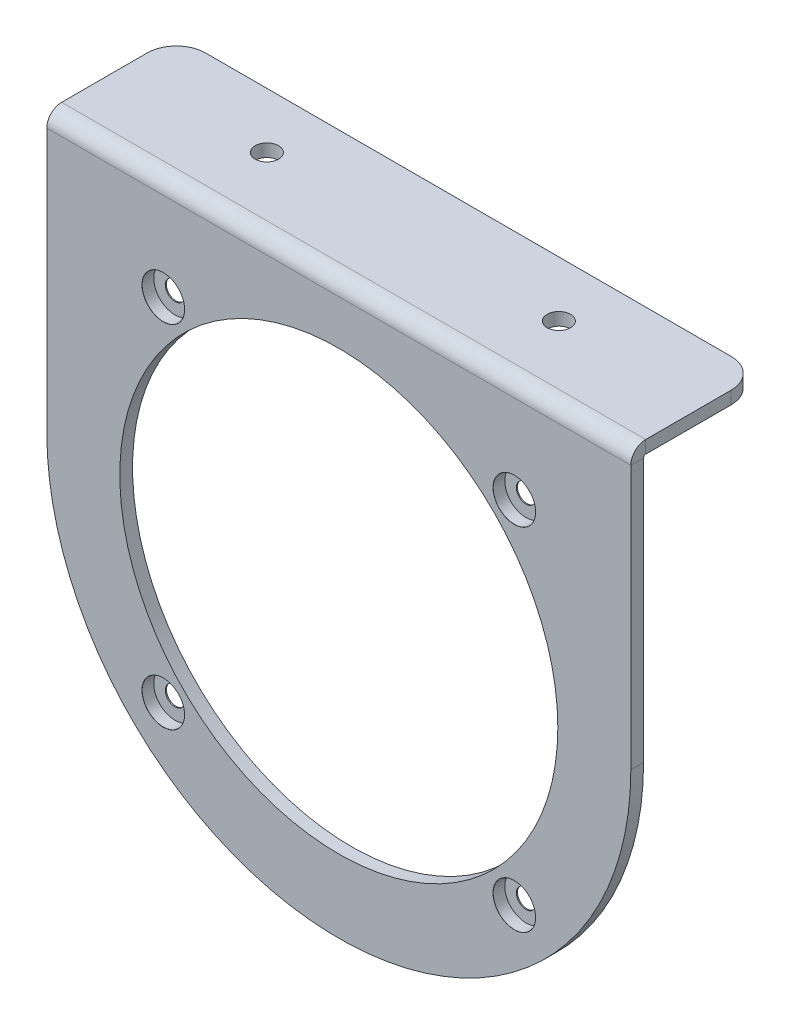
from build123d import *

# Parameters (mm, degrees)
BASE_FLANGE1_DEPTH           = 4.365
EDGE_FLANGE1_STRIP_W         = 18.9332
EDGE_FLANGE1_STRIP_H         = 4.365
EDGE_FLANGE1_STRIP_CUT_DEPTH = 200
EDGE_FLANGE1_DEPTH           = 200
SKETCH10_R                   = 75
CUT_EXTRUDE1_DEPTH           = 10
FILLET1_R                    = 10
SKETCH12_R                   = 4
CUT_EXTRUDE3_DEPTH           = 10
CIRPATTERN1_COUNT            = 4


# Sheet-metal steps are written as plain solids
with BuildPart() as part:
    # Sketch2 → Base-Flange1 (new body)
    with BuildSketch(Plane.XY):
        with BuildLine():
            Line((-100, 0), (-100, 95.4))
            Line((-100, 95.4), (100, 95.4))
            Line((100, 95.4), (100, 0))
            ThreePointArc((100, 0), (0, -100), (-100, 0))
        make_face()
    extrude(amount=-BASE_FLANGE1_DEPTH)

    # Edge-Flange1 strip (across the edge) → Edge-Flange1 strip cut (cut)
    with BuildSketch(Plane(origin=(-100, 95.4, -4.365), x_dir=(0, -1, 0), z_dir=(1, 0, 0))):
        with Locations((-4.365, -2.1825)):
            Rectangle(EDGE_FLANGE1_STRIP_W, EDGE_FLANGE1_STRIP_H)
    extrude(amount=EDGE_FLANGE1_STRIP_CUT_DEPTH, mode=Mode.SUBTRACT)

    # Edge-Flange1 section (across the edge) → Edge-Flange1 (add)
    with BuildSketch(Plane(origin=(-100, 95.4, -4.365), x_dir=(0, -1, 0), z_dir=(1, 0, 0))):
        with BuildLine():
            Line((0, 0.7366), (0, 40))
            Line((0, 40), (4.365, 40))
            Line((4.365, 40), (4.365, 0.7366))
            ThreePointArc((4.365, 0.7366), (4.580745145, 0.215745145), (5.1016, 0))
            Line((5.1016, 0), (5.1016, -4.365))
            ThreePointArc((5.1016, -4.365), (1.494224045, -2.870775955), (0, 0.7366))
        make_face()
    extrude(amount=EDGE_FLANGE1_DEPTH)

    # Sketch10 → Cut-Extrude1 (cut)
    with BuildSketch(Plane.XY):
        Circle(SKETCH10_R)
    extrude(amount=-CUT_EXTRUDE1_DEPTH, mode=Mode.SUBTRACT)

    # Fillet1
    fillet1_edges = [part.edges().sort_by_distance(p)[0] for p in [
        (-100, 93.2175, -44.365),
        (100, 93.2175, -44.365),
    ]]
    fillet(fillet1_edges, radius=FILLET1_R)

    # Sketch12 → Cut-Extrude3 (cut)
    with BuildSketch(Plane(origin=(0, 95.4, 0), x_dir=(1, 0, 0), z_dir=(0, 1, 0))):
        with Locations(Location((-50, 25.365, 0), (0, 0, 270))):
            Circle(SKETCH12_R)
        with Locations(Location((50, 25.365, 0), (0, 0, 90))):
            Circle(SKETCH12_R)
    extrude(amount=-CUT_EXTRUDE3_DEPTH, mode=Mode.SUBTRACT)

    # Sketch14 → CBORE for M6 Hex Head Screw1 (revolve, cut)
    with BuildSketch(Plane(origin=(-60.104076401, 60.104076401, 0), x_dir=(0, -1, 0), z_dir=(1, 0, 0))):
        Polygon((0, 0), (0, 44.365), (3.3, 44.365), (3.3, 4), (7.2735, 4), (7.2735, 0.025), (7.2985, 0), align=None)
    cbore_for_m6_hex_head_screw1 = revolve(axis=Axis((-60.104076401, 60.104076401, 6.35), (0, 0, -1)), mode=Mode.SUBTRACT)

    # CirPattern1: CBORE for M6 Hex Head Screw1 ×4 about axis
    cirpattern1_axis = Axis((0, 0, 0), (0, 0, 1))
    for i in range(1, CIRPATTERN1_COUNT):
        add(cbore_for_m6_hex_head_screw1.rotate(cirpattern1_axis, i * 360 / CIRPATTERN1_COUNT), mode=Mode.SUBTRACT)


solid = part.part
